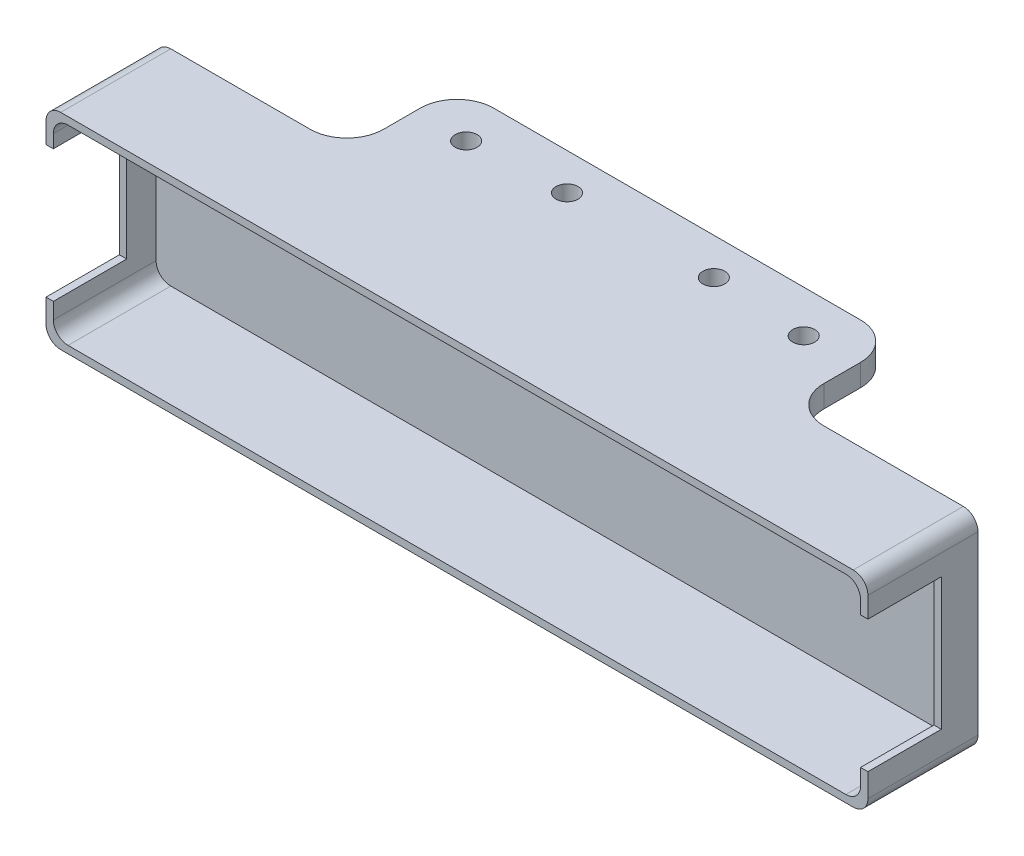
from build123d import *

# Parameters (mm, degrees)
SKETCH1_W           = 50
SKETCH1_H           = 15
SKETCH1_R           = 1.5
BOSS_EXTRUDE1_DEPTH = 3
SKETCH8_W           = 112
SKETCH8_H           = 28
BOSS_EXTRUDE3_DEPTH = 15
BOSS_EXTRUDE4_DEPTH = 3
FILLET3_R           = 1.5
FILLET4_R           = 2
SKETCH11_W          = 110
SKETCH11_H          = 26
CUT_EXTRUDE1_DEPTH  = 14
FILLET6_R           = 2
FILLET7_R           = 2
FILLET8_R           = 2
FILLET9_R           = 2
SKETCH12_W          = 10
SKETCH12_H          = 18
CUT_EXTRUDE2_DEPTH  = 138
SKETCH14_W          = 5
SKETCH14_H          = 3
BOSS_EXTRUDE5_DEPTH = 15
SKETCH15_W          = 5
SKETCH15_H          = 3
BOSS_EXTRUDE6_DEPTH = 15
FILLET12_R          = 5
FILLET13_R          = 5
FILLET14_R          = 5


with BuildPart() as part:
    # Sketch1 → Boss-Extrude1 (new body)
    with BuildSketch(Plane(origin=(0, 0, -9.678822938), x_dir=(1, 0, 0), z_dir=(0, 1, 0))):
        with Locations((-9.059405941, 3.134884125)):
            Rectangle(SKETCH1_W, SKETCH1_H)
        with Locations(Location((-19.059405941, 5.634884125, 0), (0, 0, 270))):
            Circle(SKETCH1_R, mode=Mode.SUBTRACT)
        with Locations(Location((0.940594059, 5.634884125, 0), (0, 0, 270))):
            Circle(SKETCH1_R, mode=Mode.SUBTRACT)
        with Locations(Location((-32.059405941, 4.884884125, 0), (0, 0, 270))):
            Circle(SKETCH1_R, mode=Mode.SUBTRACT)
        with Locations(Location((13.940594059, 4.884884125, 0), (0, 0, 270))):
            Circle(SKETCH1_R, mode=Mode.SUBTRACT)
    extrude(amount=BOSS_EXTRUDE1_DEPTH)

    # Sketch9 → Boss-Extrude4 (add)
    with BuildSketch(Plane.XZ):
        Polygon((-27.059405941, -10.313707063), (8.940594059, -10.313707063), (11.940594059, -5.313707063), (-30.059405941, -5.313707063), align=None)
    extrude(amount=BOSS_EXTRUDE4_DEPTH)

    # Fillet3
    fillet3_edges = [part.edges().sort_by_distance(p)[0] for p in [
        (-27.059405941, -1.5, -10.313707063),
        (8.940594059, -1.5, -10.313707063),
    ]]
    fillet(fillet3_edges, radius=FILLET3_R)


with BuildPart() as body_2:
    # Sketch8 → Boss-Extrude3 (new body)
    with BuildSketch(Plane.XY.offset(-5.313707063)):
        with Locations((-9.059405941, 1.5)):
            Rectangle(SKETCH8_W, SKETCH8_H)
    extrude(amount=BOSS_EXTRUDE3_DEPTH)

    # Fillet4
    fillet4_edges = [body_2.edges().sort_by_distance(p)[0] for p in [
        (-65.059405941, 15.5, 2.186292937),
        (46.940594059, 15.5, 2.186292937),
        (46.940594059, -12.5, 2.186292937),
        (-65.059405941, -12.5, 2.186292937),
    ]]
    fillet(fillet4_edges, radius=FILLET4_R)

    # Sketch11 → Cut-Extrude1 (cut)
    with BuildSketch(Plane.XY.offset(9.686292937)):
        with Locations((-9.059405941, 1.5)):
            Rectangle(SKETCH11_W, SKETCH11_H)
    extrude(amount=-CUT_EXTRUDE1_DEPTH, mode=Mode.SUBTRACT)

    # Fillet6
    fillet6_edges = [body_2.edges().sort_by_distance(p)[0] for p in [
        (-64.059405941, 14.5, 2.686292937),
    ]]
    fillet(fillet6_edges, radius=FILLET6_R)

    # Fillet7
    fillet7_edges = [body_2.edges().sort_by_distance(p)[0] for p in [
        (-64.059405941, -11.5, 2.686292937),
    ]]
    fillet(fillet7_edges, radius=FILLET7_R)

    # Fillet8
    fillet8_edges = [body_2.edges().sort_by_distance(p)[0] for p in [
        (45.940594059, -11.5, 2.686292937),
    ]]
    fillet(fillet8_edges, radius=FILLET8_R)

    # Fillet9
    fillet9_edges = [body_2.edges().sort_by_distance(p)[0] for p in [
        (45.940594059, 14.5, 2.686292937),
    ]]
    fillet(fillet9_edges, radius=FILLET9_R)

    # Sketch12 → Cut-Extrude2 (cut)
    with BuildSketch(Plane.ZY.offset(65.059405941)):
        with Locations((4.686292937, 1.694698027)):
            Rectangle(SKETCH12_W, SKETCH12_H)
    extrude(amount=-CUT_EXTRUDE2_DEPTH, mode=Mode.SUBTRACT)


with BuildPart() as part_1:
    # Body-Move/Copy1: read off the stored shape, not the designer's step
    # Body-Move/Copy1: moved
    add(part.part.moved(Location((0, 12.5, 0))))


    add(body_2.part)  # Boss-Extrude5 merges body 2
    # Sketch14 → Boss-Extrude5 (add)
    with BuildSketch(Plane(origin=(0, 0, -5.313707063), x_dir=(-1, 0, 0), z_dir=(0, 0, -1))):
        with Locations((36.559405941, 14)):
            Rectangle(SKETCH14_W, SKETCH14_H)
    extrude(amount=BOSS_EXTRUDE5_DEPTH)

    # Sketch15 → Boss-Extrude6 (add)
    with BuildSketch(Plane(origin=(0, 0, -5.313707063), x_dir=(-1, 0, 0), z_dir=(0, 0, -1))):
        with Locations((-18.440594059, 14)):
            Rectangle(SKETCH15_W, SKETCH15_H)
    extrude(amount=BOSS_EXTRUDE6_DEPTH)

    # Fillet12
    fillet12_edges = [part_1.edges().sort_by_distance(p)[0] for p in [
        (20.940594059, 14, -5.313707063),
    ]]
    fillet(fillet12_edges, radius=FILLET12_R)

    # Fillet13
    fillet13_edges = [part_1.edges().sort_by_distance(p)[0] for p in [
        (-39.059405941, 14, -5.313707063),
    ]]
    fillet(fillet13_edges, radius=FILLET13_R)

    # Fillet14
    fillet14_edges = [part_1.edges().sort_by_distance(p)[0] for p in [
        (20.940594059, 14, -20.313707063),
        (-39.059405941, 14, -20.313707063),
    ]]
    fillet(fillet14_edges, radius=FILLET14_R)


solid = part_1.part
